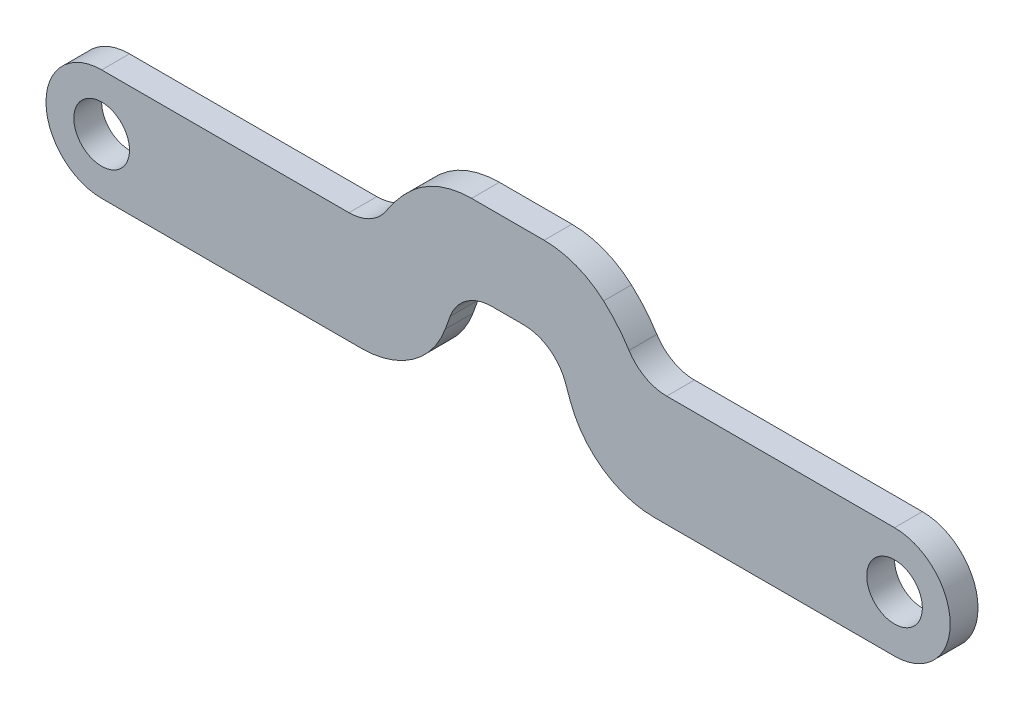
from build123d import *

# Parameters (mm, degrees)
SKETCH_1_R      = 1
EXTRUDE_1_DEPTH = 0.5
EXTRUDE1_START  = -0.5
EXTRUDE1_DEPTH  = 1
EXTRUDE2_DEPTH  = 0.5
FILLET1_R       = 1.6
FILLET2_R       = 3.2


# Read off the part's stored shape, not the designer's step: Extrude1
with BuildPart() as part:
    # Эскиз1 → Бобышка-Вытянуть1 (new, symmetric)
    with BuildSketch(Plane.XY):
        with BuildLine():
            Line((0, 2), (-28.5003, 2))
            ThreePointArc((-28.5003, 2), (-30.5003, 0), (-28.5003, -2))
            Line((-28.5003, -2), (0, -2))
            ThreePointArc((0, -2), (2, 0), (0, 2))
        make_face()
        with Locations((-28.5003, 0)):
            Circle(SKETCH_1_R, mode=Mode.SUBTRACT)
        Circle(SKETCH_1_R, mode=Mode.SUBTRACT)
    extrude(amount=EXTRUDE_1_DEPTH, both=True)

    # Extrude1 outline → Extrude1 (add)
    with BuildSketch(Plane.XY.offset(EXTRUDE1_START)):
        with BuildLine():
            ThreePointArc((-9.154212394, 2), (-13.9, 5.15), (-18.645787606, 2))
            Line((-18.645787606, 2), (-9.154212394, 2))
        make_face()
    extrude(amount=EXTRUDE1_DEPTH)

    # Sketch → Extrude2 (cut, symmetric)
    with BuildSketch(Plane.XY):
        with BuildLine():
            ThreePointArc((-11.879660865, 0.735343308), (-12.140166364, 1.235105491), (-12.521595125, 1.65))
            Line((-12.521595125, 1.65), (-15.278404875, 1.65))
            ThreePointArc((-15.278404875, 1.65), (-15.659833636, 1.235105491), (-15.920339135, 0.735343308))
            Line((-15.920339135, 0.735343308), (-16.915922679, -2))
            Line((-16.915922679, -2), (-10.884077321, -2))
            Line((-10.884077321, -2), (-11.879660865, 0.735343308))
        make_face()
        with BuildLine():
            ThreePointArc((-11.686405638, 4.65), (-13.9, 5.15), (-16.113594362, 4.65))
            Line((-16.113594362, 4.65), (-11.686405638, 4.65))
        make_face()
    extrude(amount=EXTRUDE2_DEPTH, both=True, mode=Mode.SUBTRACT)

    # Fillet1
    fillet1_edges = [part.edges().sort_by_distance(p)[0] for p in [
        (-18.645787606, 2, 0),
        (-9.154212394, 2, 0),
        (-15.278404875, 1.65, 0),
        (-12.521595125, 1.65, 0),
    ]]
    fillet(fillet1_edges, radius=FILLET1_R)

    # Fillet2
    fillet2_edges = [part.edges().sort_by_distance(p)[0] for p in [
        (-10.884077321, -2, 0),
        (-16.915922679, -2, 0),
        (-11.686405638, 4.65, 0),
        (-16.113594362, 4.65, 0),
    ]]
    fillet(fillet2_edges, radius=FILLET2_R)


solid = part.part
